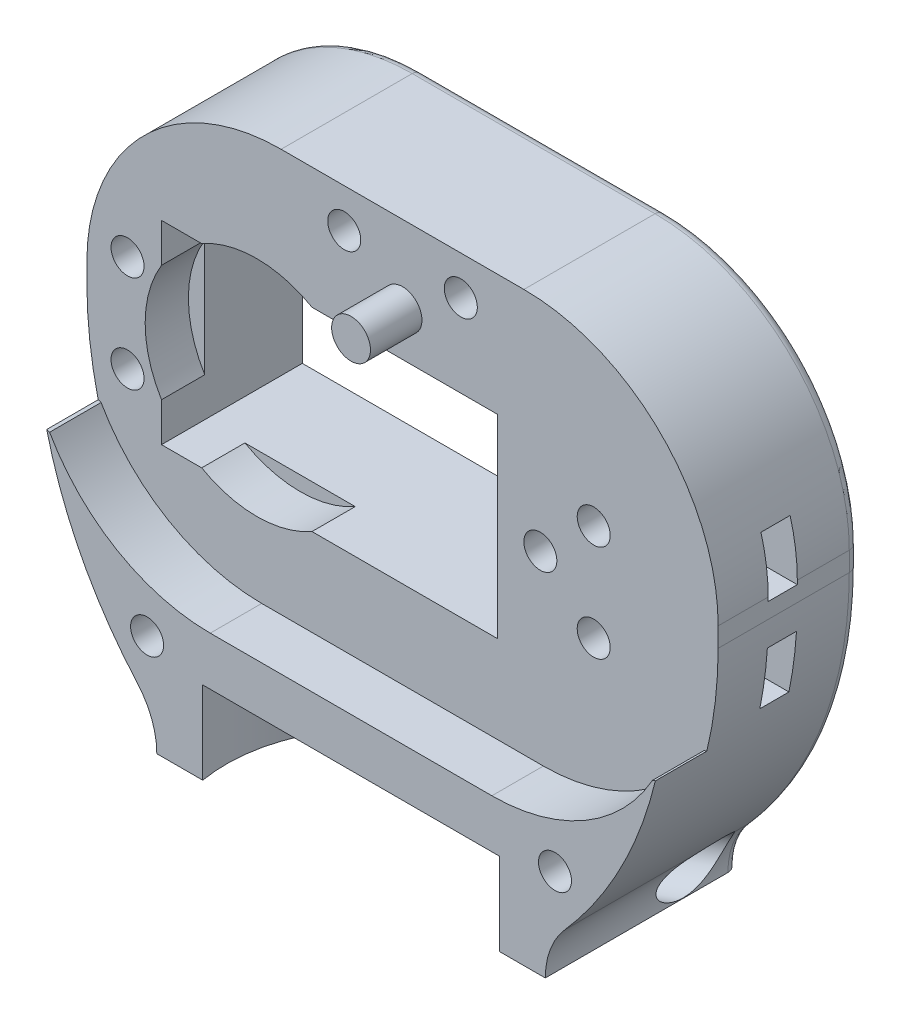
from build123d import *

# Parameters (mm, degrees)
CROQUIS1_R              = 1.7
CROQUIS1_W              = 34.6
CROQUIS1_H              = 20
SALIENTE_EXTRUIR1_DEPTH = 19.8
CROQUIS2_R              = 2
CORTAR_EXTRUIR1_DEPTH   = 5.3
REDONDEO1_R             = 1
CROQUIS3_W              = 6.4
CROQUIS3_H              = 20
CORTAR_EXTRUIR2_DEPTH   = 7.5
CROQUIS4_R              = 1.7
CORTAR_EXTRUIR3_DEPTH   = 8
CORTAR_EXTRUIR4_DEPTH   = 11.7
CORTAR_EXTRUIR5_DEPTH   = 3
CROQUIS7_R              = 1.7
CORTAR_EXTRUIR6_DEPTH   = 32
CORTAR_EXTRUIR7_DEPTH   = 11.7
CROQUIS9_R              = 15.5
CORTAR_EXTRUIR8_DEPTH   = 8.5
CORTAR_EXTRUIR9_START   = -10.5
CROQUIS10_R             = 1.7
CORTAR_EXTRUIR9_DEPTH   = 25.5
CROQUIS11_R             = 2.95
CORTAR_EXTRUIR10_DEPTH  = 10.5
CROQUIS12_R             = 11.5
CORTAR_EXTRUIR11_DEPTH  = 4.45
CORTAR_EXTRUIR12_DEPTH  = 6


with BuildPart() as part:
    # Croquis1 → Saliente-Extruir1 (new body)
    with BuildSketch(Plane.XY):
        with BuildLine():
            Line((-20, 0), (20, 0))
            ThreePointArc((20, 0), (20.516685226, 2.828427125), (22, 5.291502622))
            ThreePointArc((22, 5.291502622), (29.774696313, 18.189029951), (32.5, 33))
            Line((32.5, 33), (32.5, 35))
            ThreePointArc((32.5, 35), (26.642135624, 49.142135624), (12.5, 55))
            Line((12.5, 55), (-12.5, 55))
            ThreePointArc((-12.5, 55), (-26.642135624, 49.142135624), (-32.5, 35))
            Line((-32.5, 35), (-32.5, 33))
            ThreePointArc((-32.5, 33), (-29.774696313, 18.189029951), (-22, 5.291502622))
            ThreePointArc((-22, 5.291502622), (-20.516685226, 2.828427125), (-20, 0))
        make_face()
        with Locations(Location((19.685, 37.5, 0), (0, 0, 180))):
            Circle(CROQUIS1_R, mode=Mode.SUBTRACT)
        with Locations(Location((19.685, 27.5, 0), (0, 0, 180))):
            Circle(CROQUIS1_R, mode=Mode.SUBTRACT)
        with Locations(Location((-28.315, 37.5, 0), (0, 0, 180))):
            Circle(CROQUIS1_R, mode=Mode.SUBTRACT)
        with Locations(Location((-28.315, 27.5, 0), (0, 0, 180))):
            Circle(CROQUIS1_R, mode=Mode.SUBTRACT)
        with Locations(Location((-6, 51, 0), (0, 0, 180))):
            Circle(CROQUIS1_R, mode=Mode.SUBTRACT)
        with Locations(Location((6, 51, 0), (0, 0, 180))):
            Circle(CROQUIS1_R, mode=Mode.SUBTRACT)
        with Locations((-7.515, 32.5)):
            Rectangle(CROQUIS1_W, CROQUIS1_H, mode=Mode.SUBTRACT)
    extrude(amount=SALIENTE_EXTRUIR1_DEPTH)

    # Croquis2 → Cortar-Extruir1 (cut)
    with BuildSketch(Plane.XY.offset(19.8)):
        with BuildLine():
            Line((-14.5, 13.5), (14.5, 13.5))
            ThreePointArc((14.5, 13.5), (28.068203525, 19.199479216), (33.496228734, 32.878541777))
            ThreePointArc((33.496228734, 32.878541777), (0, 120), (-33.496228734, 32.878541777))
            ThreePointArc((-33.496228734, 32.878541777), (-28.068203525, 19.199479216), (-14.5, 13.5))
        make_face()
        with Locations((0, 47)):
            Circle(CROQUIS2_R, mode=Mode.SUBTRACT)
    extrude(amount=-CORTAR_EXTRUIR1_DEPTH, mode=Mode.SUBTRACT)

    # Redondeo1
    redondeo1_edges = [part.edges().sort_by_distance(p)[0] for p in [
        (-32.5, 34, 0),
        (-26.642135624, 49.142135624, 0),
        (0, 55, 0),
        (26.642135624, 49.142135624, 0),
        (32.5, 34, 0),
        (29.774696313, 18.189029951, 0),
        (20.516685226, 2.828427125, 0),
        (-20.516685226, 2.828427125, 0),
        (-29.774696313, 18.189029951, 0),
    ]]
    fillet(redondeo1_edges, radius=REDONDEO1_R)

    # Chaflán1
    # the kernel refuses this chamfer: 1, 0.825041692 mm, written as the material it takes off along each edge
    with BuildSketch(Plane(origin=(31.521229792, 24.05738569, 22.443985688), x_dir=(-0.46842529578989384, -0.8835031082368362, 0), z_dir=(0, 0, -1))) as chafl_n1_piece_1:
        with BuildLine():
            Line((1.028197231, 0), (0.801835652, -0.214430341))
            ThreePointArc((0.801835652, -0.214430341), (0.390274265, -0.106489922), (0, 0))
            ThreePointArc((0, 0), (0.528634069, -0.006950908), (1.028197231, 0))
        make_face()
    extrude(amount=7.943985688, mode=Mode.SUBTRACT)
    with BuildSketch(Plane(origin=(-31.521229792, 24.05738569, 22.443985688), x_dir=(0.22427400175018, -0.9745261269657989, 0), z_dir=(0, 0, -1))) as chafl_n1_piece_2:
        with BuildLine():
            Line((0.830012521, 0), (0.993292483, -0.265630551))
            ThreePointArc((0.993292483, -0.265630551), (0.512483991, -0.129855509), (0, 0))
            ThreePointArc((0, 0), (0.404536656, 0.002049093), (0.830012521, 0))
        make_face()
    extrude(amount=7.943985688, mode=Mode.SUBTRACT)

    # Croquis3 → Cortar-Extruir2 (cut)
    with BuildSketch(Plane(origin=(0, 0, 0), x_dir=(-1, 0, 0), z_dir=(0, 0, -1))):
        with Locations((-12.985, 32.5)):
            Rectangle(CROQUIS3_W, CROQUIS3_H)
    extrude(amount=-CORTAR_EXTRUIR2_DEPTH, mode=Mode.SUBTRACT)

    # Croquis4 → Cortar-Extruir3 (cut)
    with BuildSketch(Plane.XY.offset(14.5)):
        with Locations((14.19, 32.5)):
            Circle(CROQUIS4_R)
    extrude(amount=-CORTAR_EXTRUIR3_DEPTH, mode=Mode.SUBTRACT)

    # Croquis5 → Cortar-Extruir4 (cut)
    with BuildSketch(Plane(origin=(0, 0, 0), x_dir=(-1, 0, 0), z_dir=(0, 0, -1))):
        Polygon((-17.091185103, 34.175), (-17.091185103, 30.825), (-14.19, 29.15), (-11.288814897, 30.825), (-11.288814897, 34.175), (-14.19, 35.85), align=None)
    extrude(amount=-CORTAR_EXTRUIR4_DEPTH, mode=Mode.SUBTRACT)

    # Croquis6 → Cortar-Extruir5 (cut)
    with BuildSketch(Plane.XY.offset(6.35)):
        Polygon((22.36, 40.401185103), (38.01, 40.401185103), (38.01, 34.598814897), (22.36, 34.598814897), (18.01, 34.598814897), (16.335, 37.5), (18.01, 40.401185103), align=None)
        Polygon((-24.965, 37.5), (-26.64, 40.401185103), (-30.79, 40.401185103), (-46.64, 40.401185103), (-46.64, 34.598814897), (-30.79, 34.598814897), (-26.64, 34.598814897), align=None)
        Polygon((-24.965, 27.5), (-26.64, 30.401185103), (-30.79, 30.401185103), (-46.64, 30.401185103), (-46.64, 24.598814897), (-30.79, 24.598814897), (-26.64, 24.598814897), align=None)
        Polygon((22.36, 30.401185103), (18.01, 30.401185103), (16.335, 27.5), (18.01, 24.598814897), (22.36, 24.598814897), (38.01, 24.598814897), (38.01, 30.401185103), align=None)
    extrude(amount=CORTAR_EXTRUIR5_DEPTH, mode=Mode.SUBTRACT)

    # Croquis7 → Cortar-Extruir6 (cut)
    with BuildSketch(Plane.XY.offset(19.8)):
        with Locations((-21, 10)):
            Circle(CROQUIS7_R)
        with Locations((21, 10)):
            Circle(CROQUIS7_R)
    extrude(amount=-CORTAR_EXTRUIR6_DEPTH, mode=Mode.SUBTRACT)

    # Croquis8 → Cortar-Extruir7 (cut)
    with BuildSketch(Plane(origin=(0, 0, 0), x_dir=(-1, 0, 0), z_dir=(0, 0, -1))):
        Polygon((-18.098814897, 11.675), (-21, 13.35), (-23.901185103, 11.675), (-23.901185103, 8.325), (-21, 6.65), (-18.098814897, 8.325), align=None)
        Polygon((18.098814897, 11.675), (18.098814897, 8.325), (21, 6.65), (23.901185103, 8.325), (23.901185103, 11.675), (21, 13.35), align=None)
    extrude(amount=-CORTAR_EXTRUIR7_DEPTH, mode=Mode.SUBTRACT)

    # Croquis9 → Cortar-Extruir8 (cut)
    with BuildSketch(Plane.XZ):
        with Locations((0, 17.15)):
            Circle(CROQUIS9_R)
    extrude(amount=-CORTAR_EXTRUIR8_DEPTH, mode=Mode.SUBTRACT)

    # Croquis10 → Cortar-Extruir9 (cut)
    with BuildSketch(Plane(origin=(-7.426167837, 0, -4.2875), x_dir=(0, 1, 0), z_dir=(0.8660254037844398, 0, 0.499999999999998)).offset(CORTAR_EXTRUIR9_START)):
        with Locations(Location((3, 14.850778558, 0), (0, 0, 90))):
            Circle(CROQUIS10_R)
    cortar_extruir9 = extrude(amount=CORTAR_EXTRUIR9_DEPTH, mode=Mode.SUBTRACT)

    # Croquis11 → Cortar-Extruir10 (cut)
    with BuildSketch(Plane(origin=(-9.825058206, 0, -5.6725), x_dir=(0, 1, 0), z_dir=(0.8660254037844398, 0, 0.499999999999998))):
        with Locations(Location((3, 14.850778558, 0), (0, 0, 270))):
            Circle(CROQUIS11_R)
    cortar_extruir10 = extrude(amount=-CORTAR_EXTRUIR10_DEPTH, mode=Mode.SUBTRACT)

    # Simetría1: Cortar-Extruir9, Cortar-Extruir10 across plane
    add(cortar_extruir9.mirror(Plane(origin=(0, 0, 0), x_dir=(0, 0, 1), z_dir=(1, 0, 0))), mode=Mode.SUBTRACT)
    add(cortar_extruir10.mirror(Plane(origin=(0, 0, 0), x_dir=(0, 0, 1), z_dir=(1, 0, 0))), mode=Mode.SUBTRACT)

    # Croquis12 → Cortar-Extruir11 (cut)
    with BuildSketch(Plane.XY.offset(14.5)):
        with Locations((-15, 32.5)):
            Circle(CROQUIS12_R)
    extrude(amount=-CORTAR_EXTRUIR11_DEPTH, mode=Mode.SUBTRACT)

    # Croquis13 → Cortar-Extruir12 (cut)
    with BuildSketch(Plane(origin=(0, 0, 0), x_dir=(-1, 0, 0), z_dir=(0, 0, -1))):
        Polygon((-9.35, 51), (-7.675, 48.098814897), (-4.325, 48.098814897), (-2.65, 51), (-4.325, 53.901185103), (-7.675, 53.901185103), align=None)
        Polygon((2.65, 51), (4.325, 48.098814897), (7.675, 48.098814897), (9.35, 51), (7.675, 53.901185103), (4.325, 53.901185103), align=None)
    extrude(amount=-CORTAR_EXTRUIR12_DEPTH, mode=Mode.SUBTRACT)


solid = part.part
